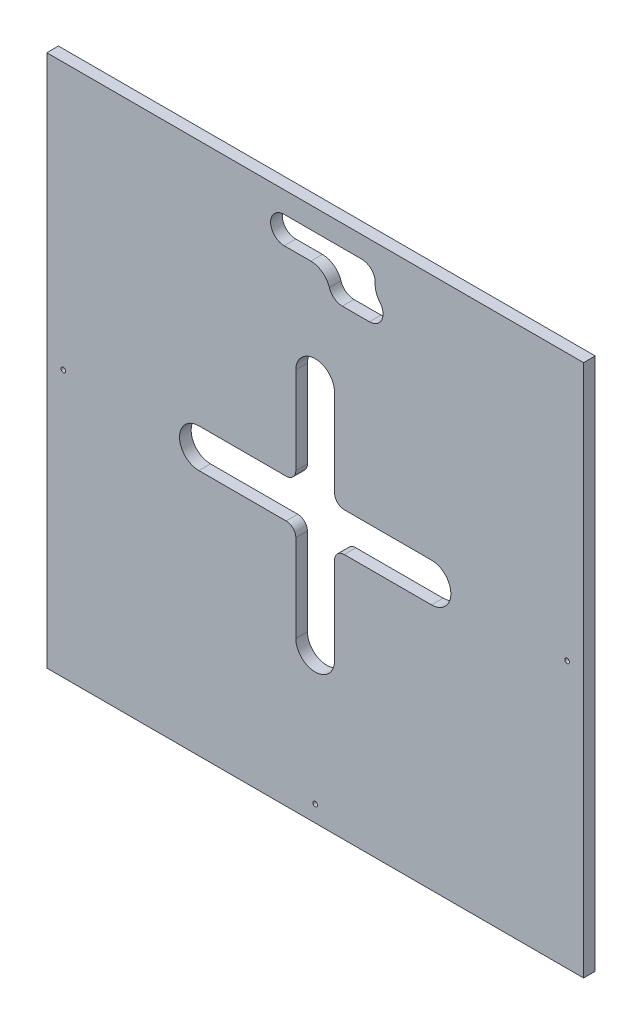
from build123d import *

# Parameters (mm, degrees)
CROQUIS1_W                   = 277
CROQUIS1_H                   = 275
BRIDA_BASE1_DEPTH            = 6
CORTAR_EXTRUIR4_DEPTH        = 10
REDONDEO2_R                  = 10
TALADRO_DE_MARGEN_PARA_M21_D = 2.4
CORTAR_EXTRUIR5_DEPTH        = 196.254961669
MATRIZC1_COUNT               = 4
REDONDEO3_R                  = 5


# Sheet-metal steps are written as plain solids
with BuildPart() as part:
    # Croquis1 → Brida base1 (new body)
    with BuildSketch(Plane.XY):
        Rectangle(CROQUIS1_W, CROQUIS1_H)
    extrude(amount=-BRIDA_BASE1_DEPTH)

    # Croquis6 → Cortar-Extruir4 (cut)
    with BuildSketch(Plane(origin=(0, 0, -6), x_dir=(-1, 0, 0), z_dir=(0, 0, -1))):
        with BuildLine():
            Line((-9.101020514, 112.5), (16, 112.5))
            ThreePointArc((16, 112.5), (23, 119.5), (16, 126.5))
            Line((16, 126.5), (-24, 126.5))
            ThreePointArc((-24, 126.5), (-30.494583009, 122.111587935), (-28.846049894, 114.448683298))
            ThreePointArc((-28.846049894, 114.448683298), (-28.423802379, 114.487159047), (-28, 114.5))
            Line((-28, 114.5), (-14, 114.5))
            ThreePointArc((-14, 114.5), (-11.354248689, 113.980740698), (-9.101020514, 112.5))
        make_face()
        with BuildLine():
            ThreePointArc((-14, 100.5), (-7.519259302, 104.854248689), (-9.101020514, 112.5))
            Line((-9.101020514, 112.5), (-24, 112.5))
            ThreePointArc((-24, 112.5), (-26.611587935, 113.005416991), (-28.846049894, 114.448683298))
            ThreePointArc((-28.846049894, 114.448683298), (-34.987159047, 107.076197621), (-28, 100.5))
            Line((-28, 100.5), (-14, 100.5))
        make_face()
        with BuildLine():
            Line((-24, 112.5), (-9.101020514, 112.5))
            ThreePointArc((-9.101020514, 112.5), (-11.354248689, 113.980740698), (-14, 114.5))
            Line((-14, 114.5), (-28, 114.5))
            ThreePointArc((-28, 114.5), (-28.423802379, 114.487159047), (-28.846049894, 114.448683298))
            ThreePointArc((-28.846049894, 114.448683298), (-26.611587935, 113.005416991), (-24, 112.5))
        make_face()
    extrude(amount=-CORTAR_EXTRUIR4_DEPTH, mode=Mode.SUBTRACT)

    # Redondeo2
    redondeo2_edges = [part.edges().sort_by_distance(p)[0] for p in [
        (28.846049894, 114.448683298, -3),
        (9.101020514, 112.5, -3),
    ]]
    fillet(redondeo2_edges, radius=REDONDEO2_R)

    # Taladro de margen para M21 (through all)
    with Locations(Plane(origin=(0, 0, -6), x_dir=(-1, 0, 0), z_dir=(0, 0, -1))):
        with Locations((-130, 0), (130, 0), (0, -129)):
            Hole(TALADRO_DE_MARGEN_PARA_M21_D / 2)

    # Croquis16 → Cortar-Extruir5 (cut, through all)
    with BuildSketch(Plane(origin=(0, 0, -6), x_dir=(-1, 0, 0), z_dir=(0, 0, -1))):
        with BuildLine():
            Line((10, 60), (10, -60))
            ThreePointArc((10, -60), (0, -70), (-10, -60))
            Line((-10, -60), (-10, 60))
            ThreePointArc((-10, 60), (0, 70), (10, 60))
        make_face()
    cortar_extruir5 = extrude(amount=-CORTAR_EXTRUIR5_DEPTH, mode=Mode.SUBTRACT)

    # MatrizC1: Cortar-Extruir5 ×4 about axis
    matrizc1_axis = Axis((0, 0, 0), (0, 0, 1))
    for i in range(1, MATRIZC1_COUNT):
        add(cortar_extruir5.rotate(matrizc1_axis, i * 360 / MATRIZC1_COUNT), mode=Mode.SUBTRACT)

    # Redondeo3
    redondeo3_edges = [part.edges().sort_by_distance(p)[0] for p in [
        (10, 10, -3),
        (10, -10, -3),
        (-10, 10, -3),
        (-10, -10, -3),
    ]]
    fillet(redondeo3_edges, radius=REDONDEO3_R)


solid = part.part
